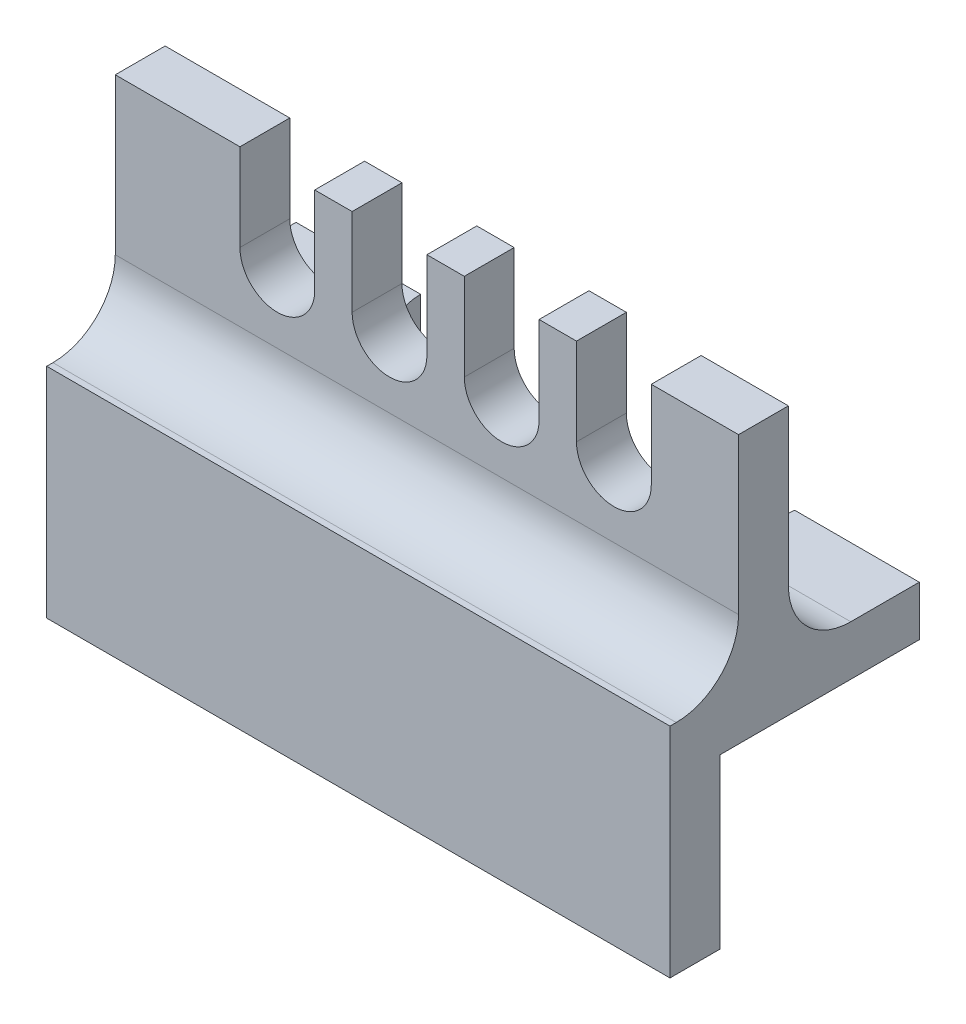
from build123d import *

# Parameters (mm, degrees)
BOSS_EXTRUDE1_DEPTH = 100
FILLET1_R           = 10
SKETCH4_W           = 60
SKETCH4_H           = 8
CUT_EXTRUDE1_DEPTH  = 10
FILLET2_R           = 10
SKETCH5_W           = 12
SKETCH5_H           = 14
CUT_EXTRUDE2_DEPTH  = 10
CUT_EXTRUDE3_DEPTH  = 10


with BuildPart() as part:
    # Sketch1 → Boss-Extrude1 (new body)
    with BuildSketch(Plane(origin=(0, 0, 0), x_dir=(0, 0, -1), z_dir=(1, 0, 0))):
        Polygon((0, 0), (0, 35), (11, 35), (11, 70), (19, 70), (19, 35), (40, 35), (40, 27), (8, 27), (8, 0), align=None)
    extrude(amount=-BOSS_EXTRUDE1_DEPTH)

    # Fillet1
    fillet1_edges = [part.edges().sort_by_distance(p)[0] for p in [
        (-50, 35, -11),
        (-50, 35, -19),
    ]]
    fillet(fillet1_edges, radius=FILLET1_R)

    # Sketch4 → Cut-Extrude1 (cut)
    with BuildSketch(Plane(origin=(0, 0, -40), x_dir=(-1, 0, 0), z_dir=(0, 0, -1))):
        with Locations((50, 31)):
            Rectangle(SKETCH4_W, SKETCH4_H)
    extrude(amount=-CUT_EXTRUDE1_DEPTH, mode=Mode.SUBTRACT)

    # Fillet2
    fillet2_edges = [part.edges().sort_by_distance(p)[0] for p in [
        (-20, 31, -30),
        (-80, 31, -30),
    ]]
    fillet(fillet2_edges, radius=FILLET2_R - 0.0001)  # a hair under: the kernel refuses the full size

    # Sketch5 → Cut-Extrude2 (cut)
    with BuildSketch(Plane(origin=(0, 0, -19), x_dir=(-1, 0, 0), z_dir=(0, 0, -1))):
        with Locations((20, 63)):
            Rectangle(SKETCH5_W, SKETCH5_H)
        with Locations((38, 63)):
            Rectangle(SKETCH5_W, SKETCH5_H)
        with Locations((74, 63)):
            Rectangle(SKETCH5_W, SKETCH5_H)
        with Locations((56, 63)):
            Rectangle(SKETCH5_W, SKETCH5_H)
    extrude(amount=-CUT_EXTRUDE2_DEPTH, mode=Mode.SUBTRACT)

    # Sketch6 → Cut-Extrude3 (cut)
    with BuildSketch(Plane(origin=(0, 0, -19), x_dir=(-1, 0, 0), z_dir=(0, 0, -1))):
        with BuildLine():
            Line((14, 58.578725951), (14, 56))
            ThreePointArc((14, 56), (20, 50), (26, 56))
            Line((26, 56), (26, 58.578725951))
            Line((26, 58.578725951), (14, 58.578725951))
        make_face()
        with BuildLine():
            Line((32, 56), (32, 58.578725951))
            Line((32, 58.578725951), (44, 58.578725951))
            Line((44, 58.578725951), (44, 56))
            ThreePointArc((44, 56), (38, 50), (32, 56))
        make_face()
        with BuildLine():
            Line((50, 56), (50, 58.578725951))
            Line((50, 58.578725951), (62, 58.578725951))
            Line((62, 58.578725951), (62, 56))
            ThreePointArc((62, 56), (56, 50), (50, 56))
        make_face()
        with BuildLine():
            Line((68, 56), (68, 58.578725951))
            Line((68, 58.578725951), (80, 58.578725951))
            Line((80, 58.578725951), (80, 56))
            ThreePointArc((80, 56), (74, 50), (68, 56))
        make_face()
    extrude(amount=-CUT_EXTRUDE3_DEPTH, mode=Mode.SUBTRACT)


solid = part.part
